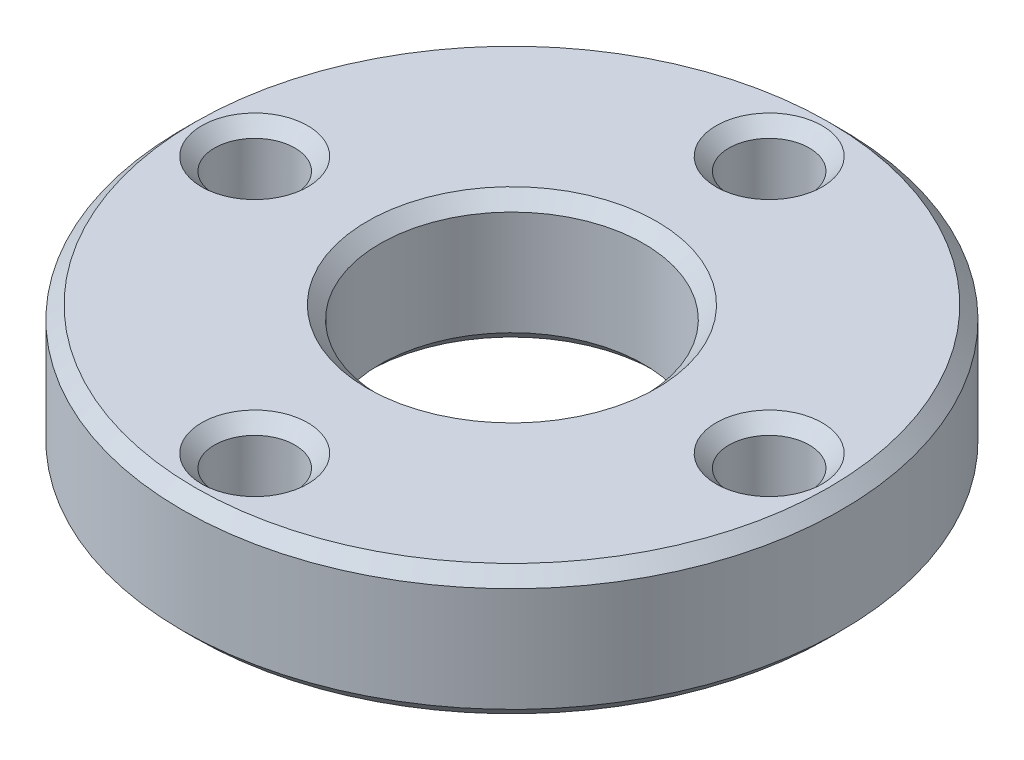
from build123d import *

# Parameters (mm, degrees)
SKETCH1_R           = 10.25
SKETCH1_R_2         = 4.1
BOSS_EXTRUDE1_DEPTH = 4.05
SKETCH4_R           = 1.25
CUT_EXTRUDE1_DEPTH  = 16.050830542
CIRPATTERN1_COUNT   = 4
CHAMFER1_SIZE       = 0.4


with BuildPart() as part:
    # Sketch1 → Boss-Extrude1 (new body)
    with BuildSketch(Plane(origin=(0, 0, 0), x_dir=(1, 0, 0), z_dir=(0, 1, 0))):
        Circle(SKETCH1_R)
        Circle(SKETCH1_R_2, mode=Mode.SUBTRACT)
    extrude(amount=-BOSS_EXTRUDE1_DEPTH)

    # Sketch4 → Cut-Extrude1 (cut, through all)
    with BuildSketch(Plane(origin=(0, 0, 0), x_dir=(1, 0, 0), z_dir=(0, 1, 0))):
        with Locations((0, 8)):
            Circle(SKETCH4_R)
    cut_extrude1 = extrude(amount=-CUT_EXTRUDE1_DEPTH, mode=Mode.SUBTRACT)

    # CirPattern1: Cut-Extrude1 ×4 about axis
    cirpattern1_axis = Axis((0, 0, 0), (0, 1, 0))
    for i in range(1, CIRPATTERN1_COUNT):
        add(cut_extrude1.rotate(cirpattern1_axis, i * 360 / CIRPATTERN1_COUNT), mode=Mode.SUBTRACT)

    # Chamfer1
    chamfer1_edges = [part.edges().sort_by_distance(p)[0] for p in [
        (1.25, -4.05, 8),
        (8, -4.05, -1.25),
        (-1.25, -4.05, -8),
        (-8, -4.05, 1.25),
        (-4.1, -4.05, 0),
        (8, 0, -1.25),
        (1.25, 0, 8),
        (-10.25, -4.05, 0),
        (-8, 0, 1.25),
        (-10.25, 0, 0),
        (-1.25, 0, -8),
        (-4.1, 0, 0),
    ]]
    chamfer(chamfer1_edges, length=CHAMFER1_SIZE)


solid = part.part
